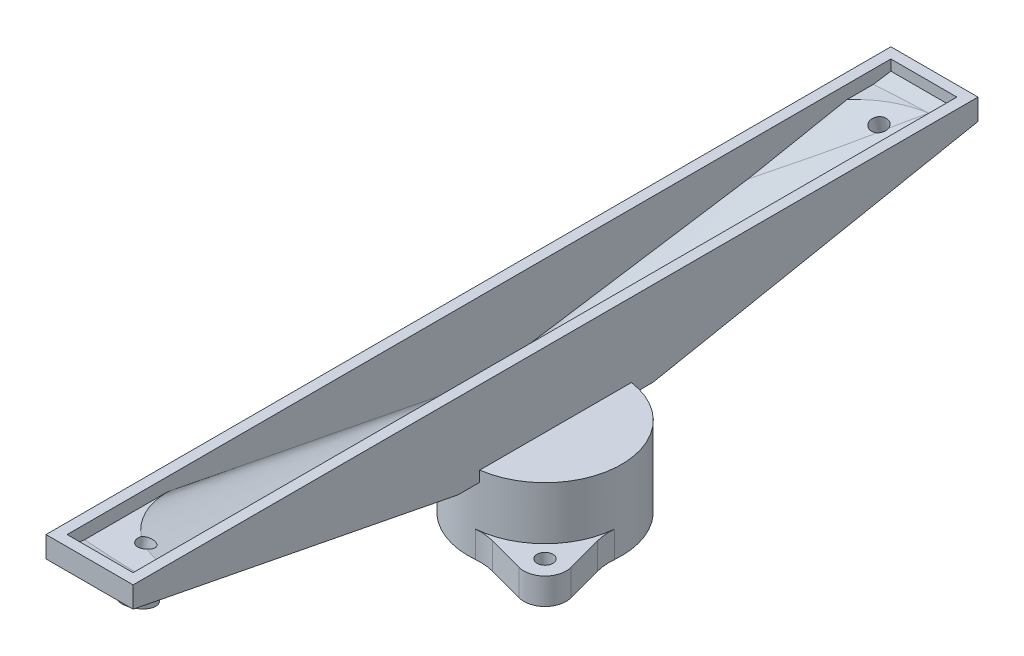
from build123d import *

# Parameters (mm, degrees)
EXTRUDE_START         = -5
EXTRUDE_1_OUTLINE_R   = 1.5
EXTRUDE_1_DEPTH       = 5
EXTRUDE_1_2_OUTLINE_R = 1.5
EXTRUDE_1_2_DEPTH     = 5
SKETCH_2_R            = 14.5
SKETCH_2_R_2          = 12.5
EXTRUDE_2_DEPTH       = 13
SKETCH_3_R            = 14.5
SKETCH_3_R_2          = 12.5
EXTRUDE_5_DEPTH       = 2
SKETCH_4_W            = 16.5
SKETCH_4_H            = 160
SKETCH_4_W_2          = 12.5
SKETCH_4_H_2          = 156
EXTRUDE_4_DEPTH       = 12
CUT_EXTRUDE_1_REACH   = 265.836
EXTRUDE_6_DEPTH       = 60
EXTRUDE_7_DEPTH       = 60
SKETCH_12_W           = 16.582102221
SKETCH_12_H           = 6.424530869
SKETCH_12_W_2         = 10.745747925
SKETCH_12_H_2         = 9.027697981
CUT_EXTRUDE_2_DEPTH   = 60
SKETCH_14_W           = 16.5
SKETCH_14_H           = 160
SKETCH_14_W_2         = 12.5
SKETCH_14_H_2         = 156
EXTRUDE_8_DEPTH       = 2
SKETCH_16_R           = 3
SKETCH_16_R_2         = 1.5
EXTRUDE_9_DEPTH       = 5
CUT_EXTRUDE_START     = -5
SKETCH_17_R           = 1.5
CUT_EXTRUDE_3_DEPTH   = 5
SKETCH_18_R           = 1.5
CUT_EXTRUDE_4_DEPTH   = 5


with BuildPart() as part:
    # 填料-伸長1: read off the stored shape, not the designer's step
    # 填料-伸長1 outline → 填料-伸長1 (new body)
    with BuildSketch(Plane(origin=(0, 10.156954032, 0), x_dir=(1, 0, 0), z_dir=(0, 1, 0)).offset(EXTRUDE_START)):
        with BuildLine():
            Line((-54.445663034, -194.741719927), (-47.541721945, -196.591625367))
            ThreePointArc((-47.541721945, -196.591625367), (-43.67801864, -195.556349186), (-42.64274246, -191.692645881))
            Line((-42.64274246, -191.692645881), (-44.492647899, -184.788704792))
            ThreePointArc((-44.492647899, -184.788704792), (-44.796491977, -183.058763578), (-44.792972571, -181.302345222))
            ThreePointArc((-44.792972571, -181.302345222), (-48.981319499, -190.253048327), (-57.932022604, -194.441395255))
            ThreePointArc((-57.932022604, -194.441395255), (-56.175604248, -194.43787585), (-54.445663034, -194.741719927))
        make_face()
        with Locations((-46.506445765, -192.727922061)):
            Circle(EXTRUDE_1_OUTLINE_R, mode=Mode.SUBTRACT)
    extrude(amount=EXTRUDE_1_DEPTH)



with BuildPart() as body_2:
    # Extrude 1 2 outline → Extrude 1 2 (new body)
    with BuildSketch(Plane(origin=(0, 10.156954032, 0), x_dir=(1, 0, 0), z_dir=(0, 1, 0)).offset(EXTRUDE_START)):
        with BuildLine():
            Line((-64.023072619, -165.258280073), (-70.927013707, -163.408374633))
            ThreePointArc((-70.927013707, -163.408374633), (-74.790717013, -164.443650813), (-75.825993193, -168.307354119))
            Line((-75.825993193, -168.307354119), (-73.976087754, -175.211295208))
            ThreePointArc((-73.976087754, -175.211295208), (-73.672243676, -176.941236422), (-73.675763082, -178.697654778))
            ThreePointArc((-73.675763082, -178.697654778), (-69.487416154, -169.746951673), (-60.536713049, -165.558604745))
            ThreePointArc((-60.536713049, -165.558604745), (-62.293131405, -165.56212415), (-64.023072619, -165.258280073))
        make_face()
        with Locations((-71.962289888, -167.272077939)):
            Circle(EXTRUDE_1_2_OUTLINE_R, mode=Mode.SUBTRACT)
    extrude(amount=EXTRUDE_1_2_DEPTH)


with BuildPart() as part_1:
    add(part.part)

    add(body_2.part)  # 填料-伸長2 merges body 2
    # 草圖2 → 填料-伸長2 (add)
    with BuildSketch(Plane.XZ.offset(-5.156954032)):
        with Locations(Location((-59.234367826, 180, 0), (0, 0, 270))):
            Circle(SKETCH_2_R)
        with Locations(Location((-59.234367826, 180, 0), (0, 0, 270))):
            Circle(SKETCH_2_R_2, mode=Mode.SUBTRACT)
    extrude(amount=-EXTRUDE_2_DEPTH)

    # 草圖3 → 填料-伸長5 (add)
    # profile 1 of 4: a face of its own
    with BuildSketch(Plane(origin=(0, 18.156954032, 0), x_dir=(1, 0, 0), z_dir=(0, 1, 0))):
        with Locations(Location((-59.234367826, -180, 0), (0, 0, 95.153074257))):
            Circle(SKETCH_3_R)
        with Locations(Location((-59.234367826, -180, 0), (0, 0, 90))):
            Circle(SKETCH_3_R_2, mode=Mode.SUBTRACT)
    # profile 2 of 4: a face of its own
    with BuildSketch(Plane(origin=(0, 18.156954032, 0), x_dir=(1, 0, 0), z_dir=(0, 1, 0))):
        with BuildLine():
            Line((-73.734367826, -180), (-73.734367826, -260))
            Line((-73.734367826, -260), (-57.234367826, -260))
            Line((-57.234367826, -260), (-57.234367826, -194.361406616))
            ThreePointArc((-57.234367826, -194.361406616), (-68.754084209, -190.937321427), (-73.734367826, -180))
        make_face()
    # profile 3 of 4: a face of its own
    with BuildSketch(Plane(origin=(0, 18.156954032, 0), x_dir=(1, 0, 0), z_dir=(0, 1, 0))):
        with BuildLine():
            Line((-73.734367826, -100), (-73.734367826, -180))
            ThreePointArc((-73.734367826, -180), (-68.754084209, -169.062678573), (-57.234367826, -165.638593384))
            Line((-57.234367826, -165.638593384), (-57.234367826, -100))
            Line((-57.234367826, -100), (-73.734367826, -100))
        make_face()
    # profile 4 of 4: a face of its own
    with BuildSketch(Plane(origin=(0, 18.156954032, 0), x_dir=(1, 0, 0), z_dir=(0, 1, 0))):
        with BuildLine():
            Line((-59.234367826, -167.5), (-59.234367826, -192.5))
            ThreePointArc((-59.234367826, -192.5), (-50.395533062, -188.838834765), (-46.734367826, -180))
            ThreePointArc((-46.734367826, -180), (-50.395533062, -171.161165235), (-59.234367826, -167.5))
        make_face()
    extrude(amount=EXTRUDE_5_DEPTH)

    # 草圖4 → 填料-伸長4 (add)
    with BuildSketch(Plane(origin=(0, 20.156954032, 0), x_dir=(1, 0, 0), z_dir=(0, 1, 0))):
        with Locations((-65.484367826, -180)):
            Rectangle(SKETCH_4_W, SKETCH_4_H)
        with Locations((-65.484367826, -180)):
            Rectangle(SKETCH_4_W_2, SKETCH_4_H_2, mode=Mode.SUBTRACT)
    extrude(amount=EXTRUDE_4_DEPTH)

    # 除料-伸長1: up to this face of the body (flat: up to its plane)
    cut_extrude_1_end = Plane(part_1.part.faces().sort_by_distance((-57.234367826, 26.156954032, 180))[0])
    # 草圖7 → 除料-伸長1 (cut, up to the picked face)
    with BuildSketch(Plane.ZY.offset(73.734367826), mode=Mode.PRIVATE) as cut_extrude_1_sk1:
        Polygon((260, 30.156954032), (198.5, 18.156954032), (264.047822103, 13.706220506), (266.363809243, 29.164088167), align=None)
    cut_extrude_1_tool1 = split(extrude(cut_extrude_1_sk1.sketch, amount=-CUT_EXTRUDE_1_REACH, mode=Mode.PRIVATE), bisect_by=cut_extrude_1_end, keep=Keep.BOTH, mode=Mode.PRIVATE)
    # 草圖7 → 除料-伸長1 (cut, up to the picked face)
    with BuildSketch(Plane.ZY.offset(73.734367826), mode=Mode.PRIVATE) as cut_extrude_1_sk2:
        Polygon((95.952177897, 13.706220506), (93.636190757, 29.164088167), (100, 30.156954032), (161.5, 18.156954032), align=None)
    cut_extrude_1_tool2 = split(extrude(cut_extrude_1_sk2.sketch, amount=-CUT_EXTRUDE_1_REACH, mode=Mode.PRIVATE), bisect_by=cut_extrude_1_end, keep=Keep.BOTH, mode=Mode.PRIVATE)
    add(cut_extrude_1_tool1.solids().sort_by(Axis((-73.734368, 20.991529, 242.810826), (1, 0, 0)))[0], mode=Mode.SUBTRACT)
    add(cut_extrude_1_tool2.solids().sort_by(Axis((-73.734368, 20.991529, 117.189174), (1, 0, 0)))[0], mode=Mode.SUBTRACT)



with BuildPart() as body_2_2:
    # 草圖5 → 疊層拉伸1 section 0
    with BuildSketch(Plane(origin=(0, 32.156954032, 0), x_dir=(1, 0, 0), z_dir=(0, 1, 0))):
        with BuildLine():
            Line((-71.734367826, -258), (-59.234367826, -258))
            Line((-59.234367826, -258), (-59.234367826, -260))
            Line((-59.234367826, -260), (-71.734367826, -260))
            Line((-71.734367826, -260), (-71.734367826, -258))
        make_face()
    # 草圖6 for 疊層拉伸1 → 疊層拉伸1 section 1
    with BuildSketch(Plane(origin=(0, 20.156954032, 0), x_dir=(1, 0, 0), z_dir=(0, 1, 0))):
        with BuildLine():
            Line((-71.734367826, -180), (-71.734367826, -190.770329614))
            # circular arc as an exact rational Bezier (weights 1, cos(half-angle), 1)
            Bezier((-71.734367826, -190.770329614), (-66.797532736, -196.5), (-59.234367826, -196.5), weights=[1, 0.909050947, 1])
            Line((-59.234367826, -196.5), (-59.234367826, -192.5))
            Bezier((-59.234367826, -192.5), (-71.734367826, -192.5), (-71.734367826, -180), weights=[1, 0.707106781, 1])
        make_face()
    loft()


with BuildPart() as part_2:
    add(part_1.part)

    add(body_2_2.part)  # 填料-伸長6 merges body 2 2
    # 草圖8 → 填料-伸長6 (add, along a direction that is not the sketch's normal)
    with BuildSketch(Plane(origin=(0, 20.156954032, 0), x_dir=(1, 0, 0), z_dir=(0, 1, 0))):
        with BuildLine():
            Line((-71.734367826, -208.75), (-59.234367826, -208.75))
            Line((-59.234367826, -208.75), (-59.234367826, -192.5))
            ThreePointArc((-59.234367826, -192.5), (-68.073202591, -188.838834765), (-71.734367826, -180))
            Line((-71.734367826, -180), (-71.734367826, -208.75))
        make_face()
    extrude(amount=EXTRUDE_6_DEPTH, dir=(-6.810459085749413e-15, 0.1915103594196487, 0.9814905920256991))

    # 草圖10 → 疊層拉伸2 section 0
    with BuildSketch(Plane(origin=(0, 32.156954032, 0), x_dir=(1, 0, 0), z_dir=(0, 1, 0))):
        with BuildLine():
            Line((-71.734367826, -102), (-59.234367826, -102))
            Line((-59.234367826, -102), (-59.234367826, -100))
            Line((-59.234367826, -100), (-71.734367826, -100))
            Line((-71.734367826, -100), (-71.734367826, -102))
        make_face()
    # 草圖9 for 疊層拉伸2 → 疊層拉伸2 section 1
    with BuildSketch(Plane(origin=(0, 20.156954032, 0), x_dir=(1, 0, 0), z_dir=(0, 1, 0))):
        with BuildLine():
            Line((-71.734367826, -180), (-71.734367826, -169.229670386))
            Bezier((-71.734367826, -169.229670386), (-66.797532736, -163.5), (-59.234367826, -163.5), weights=[1, 0.909050947, 1])
            Line((-59.234367826, -163.5), (-59.234367826, -167.5))
            Bezier((-59.234367826, -167.5), (-71.734367826, -167.5), (-71.734367826, -180), weights=[1, 0.707106781, 1])
        make_face()
    loft()

    # 草圖11 → 填料-伸長7 (add, along a direction that is not the sketch's normal)
    with BuildSketch(Plane(origin=(0, 20.156954032, 0), x_dir=(1, 0, 0), z_dir=(0, 1, 0))):
        with BuildLine():
            Line((-71.734367826, -151.25), (-71.734367826, -169.229670386))
            add(Edge.make_bspline(
                [(-71.734367826, -169.229670386), (-70.98639539, -168.36157667), (-70.129603224, -167.552057992), (-68.236734624, -166.121426347), (-67.200962736, -165.500879161), (-65.018377367, -164.50043958), (-63.872168611, -164.120824376), (-61.552791986, -163.620673884), (-60.380251531, -163.5), (-59.234367826, -163.5)],
                knots=[0, 0, 0, 0, 0.25, 0.25, 0.5, 0.5, 0.75, 0.75, 1, 1, 1, 1], degree=3))
            Line((-59.234367826, -163.5), (-59.234367826, -151.25))
            Line((-59.234367826, -151.25), (-71.734367826, -151.25))
        make_face()
    extrude(amount=EXTRUDE_7_DEPTH, dir=(0, 0.1915103594196487, -0.9814905920256991))

    # 草圖12 → 除料-伸長2 (cut)
    with BuildSketch(Plane(origin=(-57.234367826, 0, 0), x_dir=(0, 0, -1), z_dir=(1, 0, 0))):
        with Locations((-91.708948889, 28.944688598)):
            Rectangle(SKETCH_12_W, SKETCH_12_H)
        with Locations((-265.372873962, 27.643105042)):
            Rectangle(SKETCH_12_W_2, SKETCH_12_H_2)
    extrude(amount=-CUT_EXTRUDE_2_DEPTH, mode=Mode.SUBTRACT)

    # 草圖14 → 填料-伸長8 (add)
    with BuildSketch(Plane(origin=(0, 32.156954032, 0), x_dir=(1, 0, 0), z_dir=(0, 1, 0))):
        with Locations((-65.484367826, -180)):
            Rectangle(SKETCH_14_W, SKETCH_14_H)
        with Locations((-65.484367826, -180)):
            Rectangle(SKETCH_14_W_2, SKETCH_14_H_2, mode=Mode.SUBTRACT)
    extrude(amount=EXTRUDE_8_DEPTH)

    # 草圖16 → 填料-伸長9 (add)
    with BuildSketch(Plane(origin=(0, 47.847472623, 9.336092219), x_dir=(1, 0, 0), z_dir=(0, -0.981490592025699, -0.19151035941964872))):
        with Locations(Location((-65.484367826, 102.572898444, 0), (0, 0, 90))):
            Circle(SKETCH_16_R)
        with Locations(Location((-65.484367826, 102.572898444, 0), (0, 0, 270))):
            Circle(SKETCH_16_R_2, mode=Mode.SUBTRACT)
    extrude_9 = extrude(amount=EXTRUDE_9_DEPTH)

    # 草圖17 → 除料-伸長3 (cut)
    with BuildSketch(Plane(origin=(0, 47.847472623, 9.336092219), x_dir=(1, 0, 0), z_dir=(0, -0.981490592025699, -0.19151035941964872)).offset(CUT_EXTRUDE_START)):
        with Locations(Location((-65.484367826, 102.572898444, 0), (0, 0, 57.025282915))):
            Circle(SKETCH_17_R)
    extrude(amount=CUT_EXTRUDE_3_DEPTH, mode=Mode.SUBTRACT)

    # 鏡射1: 填料-伸長9 across plane
    add(extrude_9.mirror(Plane(origin=(0, 0, 180), x_dir=(1, 0, 0), z_dir=(0, 0, -1))))

    # 草圖18 → 除料-伸長4 (cut)
    with BuildSketch(Plane(origin=(0, -19.820149153, 3.867346176), x_dir=(1, 0, 0), z_dir=(-4.422479578024356e-14, -0.981490592025698, 0.1915103594196541)).offset(CUT_EXTRUDE_START)):
        with Locations(Location((-65.484367826, 250.763714686, 0), (0, 0, 90))):
            Circle(SKETCH_18_R)
    extrude(amount=CUT_EXTRUDE_4_DEPTH, mode=Mode.SUBTRACT)


solid = part_2.part
